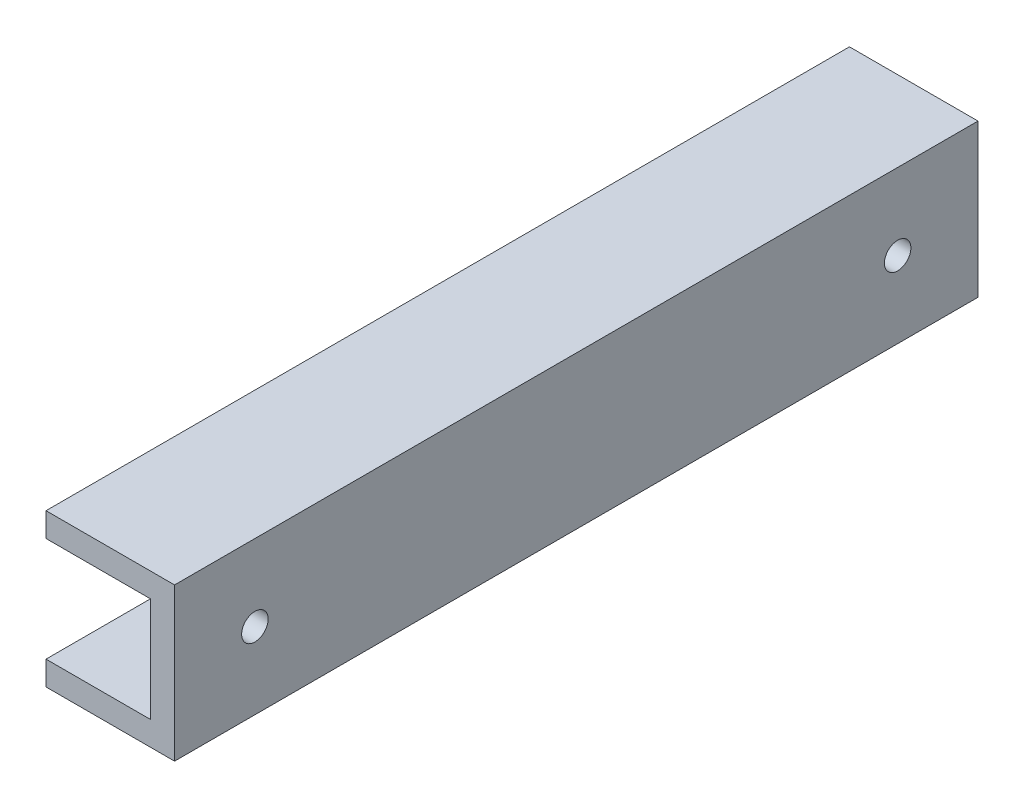
from build123d import *

# Parameters (mm, degrees)
SKETCH_1_W          = 19
SKETCH_1_H          = 19
SKETCH_1_W_2        = 13
SKETCH_1_H_2        = 13
EXTRUDE_1_DEPTH     = 100
SKETCH_2_R          = 1.65
CUT_EXTRUDE_1_DEPTH = 30
SKETCH_3_W          = 116.915177823
SKETCH_3_H          = 46.219516436
CUT_EXTRUDE_2_DEPTH = 3
SKETCH_4_W          = 5
SKETCH_4_H          = 13
EXTRUDE_1_2_DEPTH   = 10
SKETCH_5_W          = 44
SKETCH_5_H          = 5
EXTRUDE_2_DEPTH     = 10
SKETCH_6_W          = 54
SKETCH_6_H          = 13
EXTRUDE_3_DEPTH     = 10
SKETCH_8_W          = 54
SKETCH_8_H          = 5
CUT_EXTRUDE_3_DEPTH = 8
CHAMFER_1_SIZE      = 3
CHAMFER_2_SIZE      = 4
CUT_EXTRUDE_4_DEPTH = 0.3


with BuildPart() as part:
    # 草图1 → Extrude 1 (new body)
    with BuildSketch(Plane.XY):
        with Locations((6.5, 6.5)):
            Rectangle(SKETCH_1_W, SKETCH_1_H)
        with Locations((6.5, 6.5)):
            Rectangle(SKETCH_1_W_2, SKETCH_1_H_2, mode=Mode.SUBTRACT)
    extrude(amount=EXTRUDE_1_DEPTH)

    # 草图2 → 切除-拉伸1 (cut)
    with BuildSketch(Plane.ZY.offset(3)):
        with Locations((10, 6.5)):
            Circle(SKETCH_2_R)
        with Locations((90, 6.5)):
            Circle(SKETCH_2_R)
    extrude(amount=-CUT_EXTRUDE_1_DEPTH, mode=Mode.SUBTRACT)

    # 草图3 → 切除-拉伸2 (cut)
    with BuildSketch(Plane.ZY.offset(3)):
        with Locations((53.162237228, 0.202739406)):
            Rectangle(SKETCH_3_W, SKETCH_3_H)
    extrude(amount=-CUT_EXTRUDE_2_DEPTH, mode=Mode.SUBTRACT)

    # 草图4 → Extrude 1 2 (add)
    with BuildSketch(Plane.ZY.offset(-13)):
        with Locations((25.5, 6.5)):
            Rectangle(SKETCH_4_W, SKETCH_4_H)
        with Locations((74.5, 6.5)):
            Rectangle(SKETCH_4_W, SKETCH_4_H)
    extrude(amount=EXTRUDE_1_2_DEPTH)

    # 草图5 → 凸台-拉伸2 (add)
    with BuildSketch(Plane.ZY.offset(-13)):
        with Locations((50, 6.5)):
            Rectangle(SKETCH_5_W, SKETCH_5_H)
    extrude(amount=EXTRUDE_2_DEPTH)

    # 草图6 → 凸台-拉伸3 (add)
    with BuildSketch(Plane.ZY.offset(-13)):
        with Locations((50, 6.5)):
            Rectangle(SKETCH_6_W, SKETCH_6_H)
    extrude(amount=EXTRUDE_3_DEPTH)

    # 草图8 → 切除-拉伸3 (cut)
    with BuildSketch(Plane.ZY.offset(-3)):
        with Locations((50, 6.5)):
            Rectangle(SKETCH_8_W, SKETCH_8_H)
    extrude(amount=-CUT_EXTRUDE_3_DEPTH, mode=Mode.SUBTRACT)

    # 倒角1
    # the kernel refuses this chamfer: 3 mm, written as the material it takes off along each edge
    with BuildSketch(Plane(origin=(11, 4, 23), x_dir=(0.9996219169112969, 0, -0.027495876610585633), z_dir=(0, 1, 0))) as chamfer_1_piece_1_section:
        Polygon((CHAMFER_1_SIZE * 0.999621916911, -CHAMFER_1_SIZE * 0.0274958766106), (-CHAMFER_1_SIZE * 0.0274958766106, -CHAMFER_1_SIZE * 0.999621916911), (0, 0), align=None)
    chamfer_1_piece_1 = extrude(amount=5, mode=Mode.PRIVATE)
    chamfer_1_piece_1 = split(chamfer_1_piece_1, bisect_by=Plane(origin=(13, 6.5, 24.092091005), z_dir=(-1, 0, 0)), keep=Keep.TOP, mode=Mode.PRIVATE)
    add(chamfer_1_piece_1, mode=Mode.SUBTRACT)
    with BuildSketch(Plane(origin=(11, 9, 77), x_dir=(0.9996219169112968, 0, 0.02749587661058678), z_dir=(0, -1, 0))) as chamfer_1_piece_2_section:
        Polygon((CHAMFER_1_SIZE * 0.999621916911, -CHAMFER_1_SIZE * 0.0274958766106), (-CHAMFER_1_SIZE * 0.0274958766106, -CHAMFER_1_SIZE * 0.999621916911), (0, 0), align=None)
    chamfer_1_piece_2 = extrude(amount=5, mode=Mode.PRIVATE)
    chamfer_1_piece_2 = split(chamfer_1_piece_2, bisect_by=Plane(origin=(13, 6.5, 75.907908995), z_dir=(-1, 0, 0)), keep=Keep.TOP, mode=Mode.PRIVATE)
    add(chamfer_1_piece_2, mode=Mode.SUBTRACT)

    # 倒角2
    chamfer_2_edges = [part.edges().sort_by_distance(p)[0] for p in [
        (13, 11, 23),
        (13, 2, 77),
    ]]
    chamfer(chamfer_2_edges, length=CHAMFER_2_SIZE)

    # 草图9 → 切除-拉伸4 (cut)
    with BuildSketch(Plane.ZY.offset(-11)):
        with BuildLine():
            Line((40.434623193, 8.379301277), (40.469675398, 8.419574023))
            Line((40.469675398, 8.419574023), (40.691175505, 8.142885338))
            add(Edge.make_bspline(
                [(40.691175505, 8.142885338), (40.684773725, 8.130923277), (40.672128958, 8.107295864), (40.651230627, 8.070895321), (40.634847468, 8.02533662), (40.624249874, 7.968033333), (40.616757434, 7.899701609), (40.616162439, 7.850807534), (40.615850553, 7.825178114)],
                knots=[0, 0, 0, 0, 0.736410598, 1.454555069, 2.274010016, 3.348139226, 4.609940921, 6, 6, 6, 6], degree=3))
            Line((40.615850553, 7.825178114), (40.615850553, 5.258163412))
            add(Edge.make_bspline(
                [(40.615850553, 5.258163412), (40.6364881, 5.257942894), (40.674289367, 5.257538977), (40.72496882, 5.259975722), (40.764560128, 5.25975809), (40.796904896, 5.262455505), (40.831389691, 5.267072068), (40.876110093, 5.272998126), (40.93586704, 5.280243225), (41.005442806, 5.290207212), (41.076037862, 5.300698196), (41.137732149, 5.310140659), (41.185688592, 5.318566058), (41.230799444, 5.326371622), (41.275098278, 5.341744405), (41.313971946, 5.370102338), (41.338965472, 5.398872557), (41.358420213, 5.406196555), (41.365371115, 5.408813316)],
                knots=[0, 0, 0, 0, 1.271684107, 2.329311289, 3.126176351, 3.710204741, 4.32783396, 5.270448411, 6.49050515, 8.03759688, 9.602040843, 10.889228832, 11.884182716, 12.602334394, 13.712376462, 14.732953672, 15.547302315, 16, 16, 16, 16], degree=3))
            add(Edge.make_bspline(
                [(41.365371115, 5.408813316), (41.36862124, 5.406350191), (41.378062192, 5.399195312), (41.396929342, 5.382940749), (41.428210104, 5.357163062), (41.466139761, 5.32041159), (41.505070682, 5.284394071), (41.536038409, 5.255772993), (41.558280577, 5.23535707), (41.566893197, 5.214217077), (41.570486091, 5.197135671), (41.57152005, 5.187074597), (41.57195539, 5.18283846)],
                knots=[0, 0, 0, 0, 0.390394386, 1.134016561, 2.38360509, 4.269889804, 6.18981564, 7.453157385, 8.329021544, 9.032311711, 9.592562279, 10, 10, 10, 10], degree=3))
            add(Edge.make_bspline(
                [(41.57195539, 5.18283846), (41.569873725, 5.178042587), (41.565688417, 5.168400209), (41.550900852, 5.159047512), (41.531792547, 5.154080573), (41.498549745, 5.154641356), (41.450920436, 5.156215459), (41.389139184, 5.14662878), (41.322826924, 5.137430973), (41.270188996, 5.129200147), (41.230197481, 5.123392214), (41.201033493, 5.120820559), (41.164304299, 5.116697741), (41.119742147, 5.113394752), (41.067551137, 5.108765605), (41.007634969, 5.10359104), (40.940052824, 5.097441479), (40.892295871, 5.09377824), (40.867182323, 5.091851884)],
                knots=[0, 0, 0, 0, 0.341365878, 0.68633572, 1.116730632, 1.647491765, 2.890856209, 4.29325764, 5.800779701, 7.359923239, 7.845242571, 8.495183841, 9.311733456, 10.309872826, 11.474601469, 12.805924266, 14.320358265, 16, 16, 16, 16], degree=3))
            Line((40.867182323, 5.091851884), (40.656123299, 5.071715511))
            Line((40.656123299, 5.071715511), (40.539779809, 5.06202022))
            add(Edge.make_bspline(
                [(40.539779809, 5.06202022), (40.527668996, 5.05807413), (40.508040215, 5.051678447), (40.479093504, 5.05579875), (40.466528177, 5.072556897), (40.456793141, 5.090938149), (40.457528049, 5.119595339), (40.46292276, 5.159353481), (40.469899277, 5.214078954), (40.473116012, 5.255422835), (40.474895939, 5.278299785)],
                knots=[0, 0, 0, 0, 1.058270145, 1.715207142, 2.242218181, 2.723015089, 3.427046488, 4.550153686, 6.091084828, 8, 8, 8, 8], degree=3))
            Line((40.474895939, 5.278299785), (40.48459123, 5.575124844))
            Line((40.48459123, 5.575124844), (40.48459123, 7.840839738))
            add(Edge.make_bspline(
                [(40.48459123, 7.840839738), (40.484696829, 7.868932264), (40.484886538, 7.919400749), (40.483783041, 7.986265771), (40.483582078, 8.036010179), (40.481318648, 8.080499872), (40.478610247, 8.127753877), (40.474519047, 8.186348511), (40.465165421, 8.254630889), (40.451705052, 8.302382872), (40.444318484, 8.328587447)],
                knots=[0, 0, 0, 0, 1.372323329, 2.465391677, 3.267017655, 3.801925377, 4.641299591, 5.579257235, 6.671583216, 8, 8, 8, 8], degree=3))
            Line((40.444318484, 8.328587447), (40.434623193, 8.379301277))
        make_face()
        with BuildLine():
            add(Edge.make_bspline(
                [(42.538501309, 7.059995928), (42.549672943, 7.083122973), (42.571193635, 7.1276742), (42.602583585, 7.192027143), (42.631867546, 7.251111219), (42.65691417, 7.305937677), (42.680269008, 7.355297781), (42.701069516, 7.399719947), (42.719042556, 7.439218701), (42.737964371, 7.483070775), (42.757589183, 7.528818664), (42.77658765, 7.573627552), (42.790403558, 7.605635574), (42.797546411, 7.62256849), (42.800274162, 7.629034922)],
                knots=[0, 0, 0, 0, 1.475873638, 2.843077615, 4.114458223, 5.26483622, 6.306479236, 7.252326145, 8.083448402, 8.799989154, 9.996708352, 10.943956596, 11.596712522, 12, 12, 12, 12], degree=3))
            Line((42.800274162, 7.629034922), (42.961365149, 8.057119303))
            add(Edge.make_bspline(
                [(42.961365149, 8.057119303), (42.926328992, 8.053690613), (42.849881825, 8.046209378), (42.752321769, 8.040269262), (42.671204077, 8.035943442), (42.615543472, 8.031279319), (42.566803664, 8.026919897), (42.536756673, 8.023603272), (42.522839685, 8.022067098)],
                knots=[0, 0, 0, 0, 1.440114021, 3.142257811, 3.998086789, 4.76330671, 5.427195687, 6, 6, 6, 6], degree=3))
            Line((42.522839685, 8.022067098), (42.372189781, 7.996710183))
            add(Edge.make_bspline(
                [(42.372189781, 7.996710183), (42.365458336, 7.995295008), (42.347093115, 7.991434023), (42.313130152, 7.980890867), (42.264217211, 7.967925218), (42.226987796, 7.957262685), (42.205878254, 7.951216896)],
                knots=[0, 0, 0, 0, 0.478461291, 1.305373098, 2.472113022, 4, 4, 4, 4], degree=3))
            Line((42.205878254, 7.951216896), (42.155910216, 7.931080522))
            Line((42.155910216, 7.931080522), (42.029871435, 8.117528423))
            add(Edge.make_bspline(
                [(42.029871435, 8.117528423), (42.024549237, 8.124828252), (42.015463678, 8.137289838), (42.007921045, 8.154625158), (42.002322247, 8.166668424), (42.007340283, 8.178796008), (42.027183072, 8.176977456), (42.042164678, 8.166340757), (42.061300379, 8.156106887), (42.08331643, 8.154667556), (42.110007681, 8.153101146), (42.129570029, 8.156141514), (42.140248592, 8.15780117)],
                knots=[0, 0, 0, 0, 1.323589942, 2.259509366, 2.829398404, 3.190947808, 3.965341466, 5.19662492, 6.050472624, 7.088782, 8.410843841, 10, 10, 10, 10], degree=3))
            Line((42.140248592, 8.15780117), (42.301339579, 8.163021711))
            Line((42.301339579, 8.163021711), (42.936008234, 8.238346663))
            Line((42.936008234, 8.238346663), (42.985976272, 8.283839951))
            Line((42.985976272, 8.283839951), (43.026249019, 8.324112698))
            add(Edge.make_bspline(
                [(43.026249019, 8.324112698), (43.027497995, 8.322625965), (43.032618103, 8.316531186), (43.04364078, 8.302028356), (43.063240642, 8.278727616), (43.07805901, 8.259310023), (43.086658139, 8.248041954)],
                knots=[0, 0, 0, 0, 0.23984028, 0.983211964, 2.249351781, 4, 4, 4, 4], degree=3))
            Line((43.086658139, 8.248041954), (43.182865255, 8.127223714))
            add(Edge.make_bspline(
                [(43.182865255, 8.127223714), (43.189325715, 8.118835672), (43.200061976, 8.104896075), (43.208027002, 8.082602646), (43.199865287, 8.067498334), (43.188463863, 8.054551198), (43.169982095, 8.039000696), (43.155338892, 8.028179667), (43.147067258, 8.022067098)],
                knots=[0, 0, 0, 0, 1.419029252, 2.358201718, 2.827787952, 3.596253847, 4.642174893, 6, 6, 6, 6], degree=3))
            Line((43.147067258, 8.022067098), (43.09187868, 7.97657381))
            add(Edge.make_bspline(
                [(43.09187868, 7.97657381), (43.075750145, 7.936040512), (43.045148516, 7.859134271), (43.001057631, 7.749683405), (42.96071267, 7.652365851), (42.925286999, 7.566331698), (42.892748021, 7.492558805), (42.865885173, 7.429960703), (42.841699866, 7.379739328), (42.826906866, 7.350340757), (42.820410536, 7.337430405)],
                knots=[0, 0, 0, 0, 1.507300768, 2.859891598, 4.076963614, 5.147345159, 6.074452096, 6.862861548, 7.500626815, 8, 8, 8, 8], degree=3))
            Line((42.820410536, 7.337430405), (42.66901484, 7.050300637))
            add(Edge.make_bspline(
                [(42.66901484, 7.050300637), (42.686910298, 7.051729484), (42.721183259, 7.054465976), (42.773488028, 7.059689807), (42.830477082, 7.052504474), (42.88046141, 7.032513866), (42.92298935, 7.007846988), (42.957066996, 6.983209625), (42.989623047, 6.951187948), (43.022820211, 6.913544127), (43.056094924, 6.868614273), (43.086682857, 6.814194995), (43.118524503, 6.752053045), (43.158346152, 6.65734971), (43.201375138, 6.530634715), (43.227518851, 6.371479974), (43.240435847, 6.212023291), (43.242332154, 6.105904607), (43.243274375, 6.053177262)],
                knots=[0, 0, 0, 0, 0.660541429, 1.265053373, 1.928435853, 2.750244091, 3.225390118, 3.735570922, 4.291687282, 4.900607759, 5.580848831, 6.342918567, 7.193367346, 8.147740655, 10.119512469, 12.097611575, 14.061014616, 16, 16, 16, 16], degree=3))
            add(Edge.make_bspline(
                [(43.243274375, 6.053177262), (43.241284013, 6.011897383), (43.237502964, 5.933478866), (43.228365064, 5.822667485), (43.214728652, 5.725451558), (43.19486955, 5.61584903), (43.15984657, 5.494759806), (43.116580123, 5.383043812), (43.075499283, 5.302558798), (43.040877269, 5.24918968), (43.002956286, 5.201444184), (42.962205244, 5.159661699), (42.919815753, 5.125325265), (42.878674814, 5.095794806), (42.837044361, 5.074923637), (42.783150011, 5.05748784), (42.717289827, 5.045469237), (42.664835024, 5.043061363), (42.639183176, 5.041883846)],
                knots=[0, 0, 0, 0, 1.512752116, 2.8737433, 4.067977017, 5.104892351, 6.948544146, 8.672095895, 9.482011449, 10.251829035, 10.996496654, 11.710742831, 12.38300564, 12.991319199, 13.561044299, 14.079002633, 15.060579187, 16, 16, 16, 16], degree=3))
            add(Edge.make_bspline(
                [(42.639183176, 5.041883846), (42.617303241, 5.041510893), (42.575208755, 5.040793374), (42.514151809, 5.045763875), (42.458542355, 5.057140444), (42.406389922, 5.072616523), (42.357547479, 5.097090151), (42.310893498, 5.132050637), (42.263927898, 5.175100452), (42.218897289, 5.227930443), (42.177684661, 5.288456116), (42.141649424, 5.35540578), (42.111709105, 5.427831622), (42.081944649, 5.530903554), (42.05671675, 5.662702231), (42.052222332, 5.769405989), (42.050007808, 5.821981865)],
                knots=[0, 0, 0, 0, 0.828828519, 1.594571005, 2.314948186, 2.97625877, 3.650192192, 4.371738268, 5.178272596, 6.059897072, 6.995131469, 7.947518938, 8.935744196, 9.957858231, 12.008325587, 14, 14, 14, 14], degree=3))
            Line((42.050007808, 5.821981865), (42.044787267, 6.018125057))
            Line((42.044787267, 6.018125057), (42.099975846, 6.018125057))
            add(Edge.make_bspline(
                [(42.099975846, 6.018125057), (42.104196043, 5.989038582), (42.112278096, 5.933335403), (42.12403437, 5.852969872), (42.136210683, 5.779711245), (42.149933045, 5.693016659), (42.172787202, 5.595667987), (42.211289488, 5.490895406), (42.263503979, 5.402369184), (42.324810221, 5.329417503), (42.396511524, 5.27646541), (42.473268957, 5.243064329), (42.551498635, 5.227293773), (42.603330861, 5.227489835), (42.628742093, 5.227585956)],
                knots=[0, 0, 0, 0, 0.994021113, 1.903638599, 2.746793397, 3.505624798, 4.871908371, 6.122639036, 7.264652637, 8.331625701, 9.323760524, 10.250011688, 11.142051883, 12, 12, 12, 12], degree=3))
            add(Edge.make_bspline(
                [(42.628742093, 5.227585956), (42.649185049, 5.229348806), (42.689224293, 5.232801495), (42.747285543, 5.245946248), (42.80098052, 5.268375245), (42.851174653, 5.297057047), (42.896354379, 5.334459105), (42.937016376, 5.378530942), (42.971451886, 5.430887228), (43.010044394, 5.511041676), (43.047550387, 5.621545171), (43.075770668, 5.76190395), (43.094134068, 5.90507363), (43.102761092, 6.04752676), (43.10393657, 6.187867827), (43.092396682, 6.279716686), (43.086658139, 6.325391198)],
                knots=[0, 0, 0, 0, 0.647840119, 1.268849254, 1.871153999, 2.479976942, 3.088343857, 3.716462885, 4.367721208, 5.059616847, 6.52246665, 8.039623249, 9.575767262, 11.078710543, 12.547304005, 14, 14, 14, 14], degree=3))
            add(Edge.make_bspline(
                [(43.086658139, 6.325391198), (43.078633957, 6.37462159), (43.062771996, 6.471938745), (43.02608022, 6.588747848), (42.989949053, 6.675971921), (42.95771378, 6.734492332), (42.921176504, 6.786764905), (42.879789069, 6.830606684), (42.837833818, 6.866583694), (42.795721935, 6.890590256), (42.754134231, 6.902943515), (42.727485778, 6.900227585), (42.714508128, 6.898904942)],
                knots=[0, 0, 0, 0, 2.019199264, 3.991492233, 4.943861116, 5.841091039, 6.693606335, 7.520378909, 8.278781735, 8.923571305, 9.475785111, 10, 10, 10, 10], degree=3))
            Line((42.714508128, 6.898904942), (42.633962635, 6.889209651))
            Line((42.633962635, 6.889209651), (42.598910429, 6.82357999))
            add(Edge.make_bspline(
                [(42.598910429, 6.82357999), (42.594231904, 6.815400899), (42.586076085, 6.801142737), (42.574931247, 6.782296659), (42.566030004, 6.771258076), (42.559273758, 6.761742008), (42.549507042, 6.764943226), (42.543225074, 6.775882195), (42.533182769, 6.791985893), (42.526650342, 6.805816618), (42.522839685, 6.813884699)],
                knots=[0, 0, 0, 0, 1.659028505, 2.892093886, 3.763458346, 4.288089223, 4.647361994, 5.327919393, 6.441255868, 8, 8, 8, 8], degree=3))
            Line((42.522839685, 6.813884699), (42.442294192, 6.969755144))
            add(Edge.make_bspline(
                [(42.442294192, 6.969755144), (42.436472207, 6.978713571), (42.426322828, 6.994330664), (42.430722858, 7.012132855), (42.432598901, 7.019723182)],
                knots=[0, 0, 0, 0, 1.147259222, 2, 2, 2, 2], degree=3))
            Line((42.432598901, 7.019723182), (42.472871648, 7.035384805))
            Line((42.472871648, 7.035384805), (42.538501309, 7.059995928))
        make_face()
    extrude(amount=-CUT_EXTRUDE_4_DEPTH, mode=Mode.SUBTRACT)


solid = part.part
